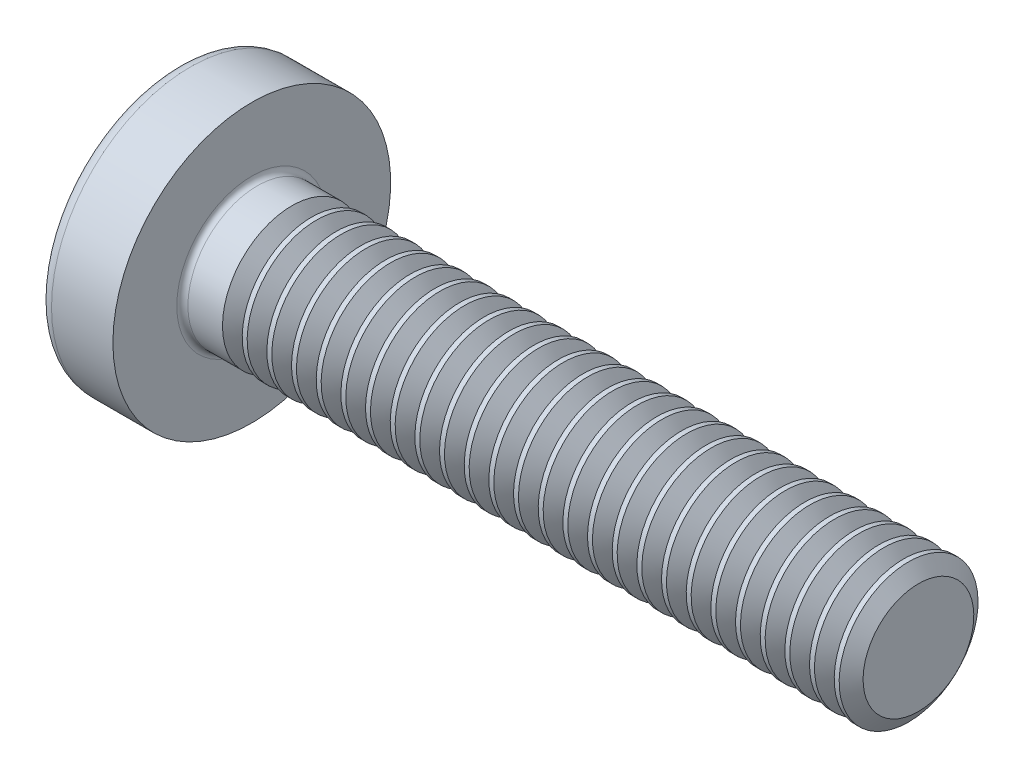
from build123d import *

# Parameters (mm, degrees)
RECPAT_COUNT    = 2
RECPAT_ANGLE    = 90
THDSCHPAT_COUNT = 26
THDSCHPAT_PITCH = 0.444


with BuildPart() as part:
    # Fillet1: read off the stored shape, not the designer's step
    # Fillet1 outline → Fillet1 (revolve)
    with BuildSketch(Plane.YX):
        with BuildLine():
            Line((1.25, 2.2), (1.25, 14.1))
            Line((1.25, 14.1), (0, 14.1))
            Line((0, 14.1), (0, 0))
            ThreePointArc((0, 0), (1.267435139, 0.206109099), (2.404255321, 0.803195916))
            ThreePointArc((2.404255321, 0.803195916), (2.474733878, 0.88781572), (2.5, 0.99500416))
            Line((2.5, 0.99500416), (2.5, 2.1))
            Line((2.5, 2.1), (1.35, 2.1))
            ThreePointArc((1.35, 2.1), (1.279289322, 2.129289322), (1.25, 2.2))
        make_face()
    revolve(axis=Axis((0, 0, 0), (1, 0, 0)))

    # Sketch3 → Recess section 0
    with BuildSketch(Plane(origin=(0, 0, 0), x_dir=(0, 0, -1), z_dir=(1, 0, 0))):
        with BuildLine():
            Line((0.37, -1.3), (-0.37, -1.3))
            Line((-0.37, -1.3), (-0.37, 1.3))
            Line((-0.37, 1.3), (0.37, 1.3))
            Line((0.37, 1.3), (0.37, -1.3))
        make_face()
    # Sketch4 → Recess section 1
    with BuildSketch(Plane(origin=(1.5, 0, 0), x_dir=(0, 0, -1), z_dir=(1, 0, 0))):
        with BuildLine():
            Line((0.37, -0.552127713), (-0.37, -0.552127713))
            Line((-0.37, -0.552127713), (-0.37, 0.552127713))
            Line((-0.37, 0.552127713), (0.37, 0.552127713))
            Line((0.37, 0.552127713), (0.37, -0.552127713))
        make_face()
    recess = loft(mode=Mode.SUBTRACT)

    # RecPat: Recess ×2 about axis
    recpat_axis = Axis((0, 0, 0), (1, 0, 0))
    for i in range(1, RECPAT_COUNT):
        add(recess.rotate(recpat_axis, i * RECPAT_ANGLE / (RECPAT_COUNT - 1)), mode=Mode.SUBTRACT)

    # RecCorSke → RecessCore (revolve, cut)
    with BuildSketch(Plane.XY, mode=Mode.PRIVATE) as recesscore_sk:
        Polygon((0, 0), (0, 0.660890218), (1.5, 0.556), (1.680655351, 0), align=None)
    revolve(recesscore_sk.sketch.rotate(Axis((-3.175, 0, 0), (1, 0, 0)), 90), axis=Axis((-3.175, 0, 0), (1, 0, 0)), mode=Mode.SUBTRACT)

    # ThdSchSke → ThreadSchematic (revolve, cut)
    with BuildSketch(Plane.XY, mode=Mode.PRIVATE) as threadschematic_sk:
        Polygon((3, -0.9965), (2.822497389, -1.25), (2.822497389, -1.5625), (3.177502611, -1.5625), (3.177502611, -1.25), align=None)
    threadschematic = revolve(threadschematic_sk.sketch.rotate(Axis((-3.175, 0, 0), (1, 0, 0)), 270), axis=Axis((-3.175, 0, 0), (1, 0, 0)), mode=Mode.SUBTRACT)

    # ThdSchPat: ThreadSchematic ×26
    with Locations(*[(i * THDSCHPAT_PITCH, 0, 0) for i in range(1, THDSCHPAT_COUNT)]):
        add(threadschematic, mode=Mode.SUBTRACT)


solid = part.part
